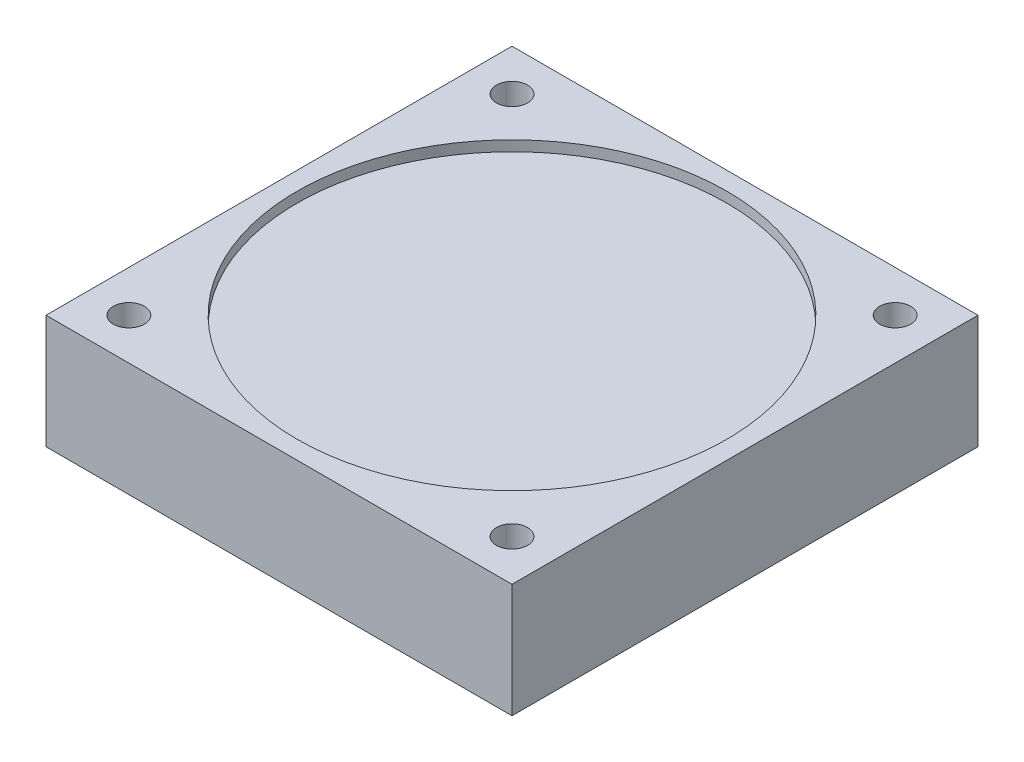
from build123d import *

# Parameters (mm, degrees)
SKETCH1_W           = 45
SKETCH1_H           = 45
SKETCH1_R           = 1.5
BOSS_EXTRUDE1_DEPTH = 11
SKETCH2_R           = 20.75
CUT_EXTRUDE1_DEPTH  = 1


with BuildPart() as part:
    # Sketch1 → Boss-Extrude1 (new body)
    with BuildSketch(Plane(origin=(0, 0, 0), x_dir=(1, 0, 0), z_dir=(0, 1, 0))):
        with Locations((-3.662790698, 9.811046512)):
            Rectangle(SKETCH1_W, SKETCH1_H)
        with Locations((-22.162790698, 28.311046512)):
            Circle(SKETCH1_R, mode=Mode.SUBTRACT)
        with Locations((14.837209302, 28.311046512)):
            Circle(SKETCH1_R, mode=Mode.SUBTRACT)
        with Locations((-22.162790698, -8.688953488)):
            Circle(SKETCH1_R, mode=Mode.SUBTRACT)
        with Locations((14.837209302, -8.688953488)):
            Circle(SKETCH1_R, mode=Mode.SUBTRACT)
    extrude(amount=BOSS_EXTRUDE1_DEPTH)

    # Sketch2 → Cut-Extrude1 (cut)
    with BuildSketch(Plane(origin=(0, 11, 0), x_dir=(1, 0, 0), z_dir=(0, 1, 0))):
        with Locations((-3.662790698, 9.811046512)):
            Circle(SKETCH2_R)
    extrude(amount=-CUT_EXTRUDE1_DEPTH, mode=Mode.SUBTRACT)


solid = part.part
